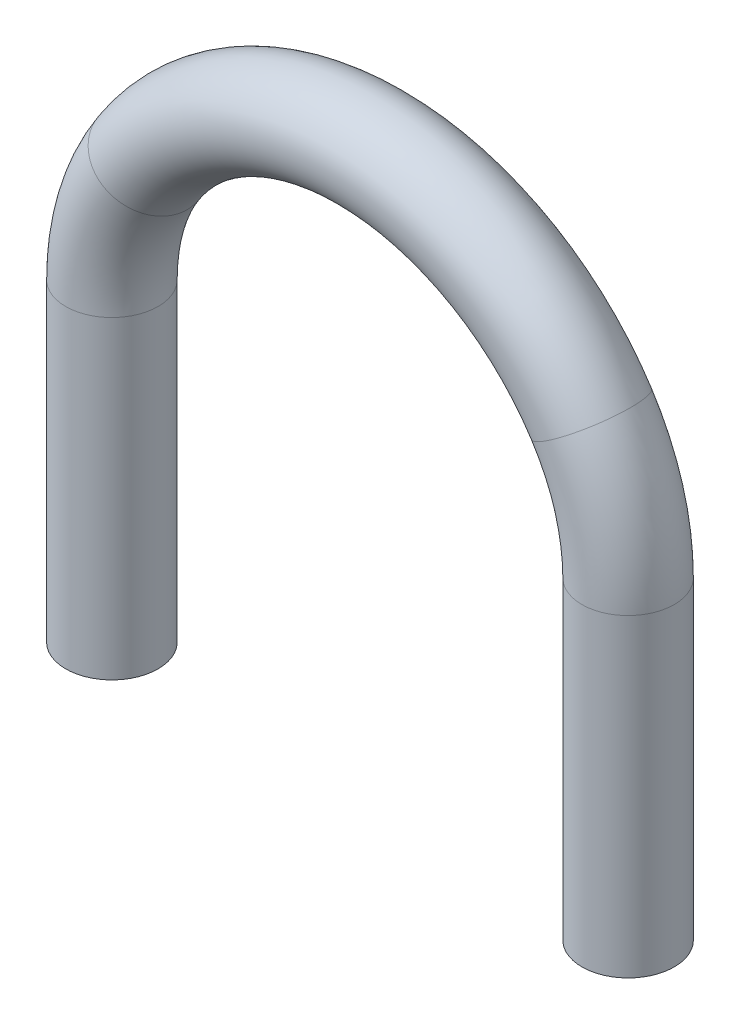
from build123d import *

# Parameters (mm, degrees)
SWEEP1_OUTLINE_R   = 5
SWEEP1_DEPTH       = 33.988332717
SWEEP1_2_OUTLINE_R = 5
SWEEP1_2_ANGLE     = 32.92809
SWEEP1_3_OUTLINE_R = 5
SWEEP1_3_ANGLE     = 114.14382
SWEEP1_4_OUTLINE_R = 5
SWEEP1_4_ANGLE     = 32.92809
SCALE7_SCALE       = 2.5


with BuildPart() as part:
    # Sweep1: read off the stored shape, not the designer's step
    # Sweep1 outline → Sweep1 (new body)
    with BuildSketch(Plane(origin=(0, 0, 0), x_dir=(1, 0, 0), z_dir=(0, 1, 0))):
        with Locations((55.902877487, 0)):
            Circle(SWEEP1_OUTLINE_R)
        Circle(SWEEP1_OUTLINE_R)
    extrude(amount=SWEEP1_DEPTH)



with BuildPart() as body_2:
    # Sweep1 2 outline → Sweep1 2 (revolve)
    with BuildSketch(Plane(origin=(31.307900209, 33.988332717, 0), x_dir=(1, 0, 0), z_dir=(0, -1, 0))):
        with Locations((24.594977278, 0)):
            Circle(SWEEP1_2_OUTLINE_R)
    revolve(axis=Axis((31.307900209, 33.988332717, 0), (0, 0, 1)), revolution_arc=SWEEP1_2_ANGLE)

    # Sweep1 3 outline → Sweep1 3 (revolve)
    with BuildSketch(Plane(origin=(27.951438743, 31.814605451, 0), x_dir=(0.8393534671240316, 0.5435860164011462, 0), z_dir=(0.5435860164011462, -0.8393534671240316, 0))):
        with Locations((28.593842592, 0)):
            Circle(SWEEP1_3_OUTLINE_R)
    revolve(axis=Axis((27.951438743, 31.814605451, 0), (0, 0, 1)), revolution_arc=SWEEP1_3_ANGLE)


with BuildPart() as part_1:
    add(part.part)

    add(body_2.part)  # Sweep1 4 merges body 2
    # Sweep1 4 outline → Sweep1 4 (revolve)
    with BuildSketch(Plane(origin=(24.594977278, 33.988332717, 0), x_dir=(-0.8393534671240301, 0.5435860164011485, 0), z_dir=(0.5435860164011485, 0.8393534671240301, 0))):
        with Locations((24.594977278, 0)):
            Circle(SWEEP1_4_OUTLINE_R)
    revolve(axis=Axis((24.594977278, 33.988332717, 0), (0, 0, 1)), revolution_arc=SWEEP1_4_ANGLE)


with BuildPart() as part_2:
    # Scale7: scaled about (27.951438772, 35.9486859, 0)
    add(part_1.part.scale(SCALE7_SCALE).moved(Location((-41.927158158, -53.92302885, 0))))


solid = part_2.part
